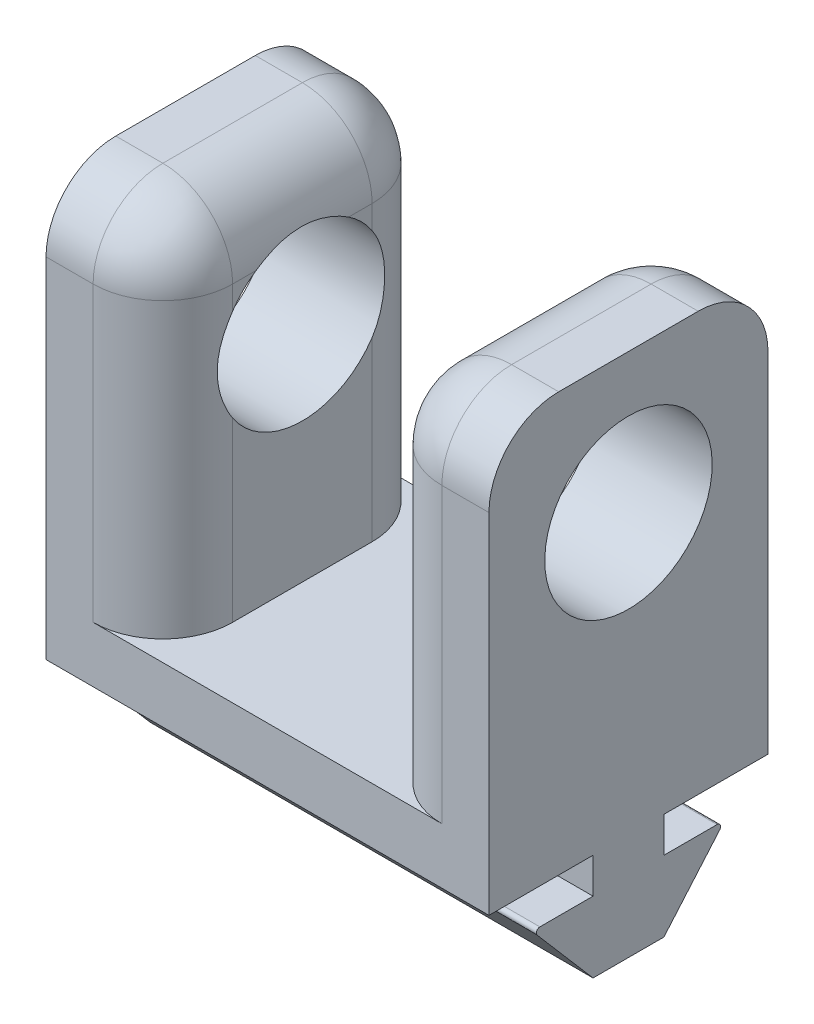
from build123d import *

# Parameters (mm, degrees)
SKETCH10_W              = 2.54
SKETCH10_H              = 5.08
SKETCH10_W_2            = 5.08
SKETCH10_H_2            = 2.54
BOSS_EXTRUDE3_DEPTH     = 31.75
SKETCH11_W              = 20
SKETCH11_H              = 4
BOSS_EXTRUDE4_DEPTH     = 31.75
CUT_EXTRUDE1_DEPTH      = 39.055781427
SKETCH13_W              = 8.375
SKETCH13_H              = 26
BOSS_EXTRUDE5_DEPTH     = 20
CUT_EXTRUDE2_DEPTH      = 50.695881369
CUT_EXTRUDE2_DEPTH_BACK = 50.695881369
SKETCH16_R              = 6
FILLET1_R               = 5


with BuildPart() as part:
    # Sketch10 → Boss-Extrude3 (new body)
    with BuildSketch(Plane(origin=(0, 0, 0), x_dir=(0, 0, -1), z_dir=(1, 0, 0))):
        with Locations((-11.43, 0)):
            Rectangle(SKETCH10_W, SKETCH10_H)
        with BuildLine():
            Line((-5.08, 2.54), (-9.740509205, 6.542688341))
            ThreePointArc((-9.740509205, 6.542688341), (-10.012022021, 6.580814495), (-10.16, 6.35))
            Line((-10.16, 6.35), (-10.16, -6.35))
            ThreePointArc((-10.16, -6.35), (-10.012022021, -6.580814495), (-9.740509205, -6.542688341))
            Line((-9.740509205, -6.542688341), (-5.08, -2.54))
            Line((-5.08, -2.54), (-5.08, 2.54))
        make_face()
        with BuildLine():
            Line((6.35, 10.16), (-6.35, 10.16))
            ThreePointArc((-6.35, 10.16), (-6.580814495, 10.012022021), (-6.542688341, 9.740509205))
            Line((-6.542688341, 9.740509205), (-2.54, 5.08))
            Line((-2.54, 5.08), (2.54, 5.08))
            Line((2.54, 5.08), (6.542688341, 9.740509205))
            ThreePointArc((6.542688341, 9.740509205), (6.580814495, 10.012022021), (6.35, 10.16))
        make_face()
        with Locations((0, 11.43)):
            Rectangle(SKETCH10_W_2, SKETCH10_H_2)
        with BuildLine():
            ThreePointArc((6.542688341, -9.740509205), (6.580814495, -10.012022021), (6.35, -10.16))
            Line((6.35, -10.16), (-6.35, -10.16))
            ThreePointArc((-6.35, -10.16), (-6.580814495, -10.012022021), (-6.542688341, -9.740509205))
            Line((-6.542688341, -9.740509205), (-2.54, -5.08))
            Line((-2.54, -5.08), (2.54, -5.08))
            Line((2.54, -5.08), (6.542688341, -9.740509205))
        make_face()
        with Locations((0, -11.43)):
            Rectangle(SKETCH10_W_2, SKETCH10_H_2)
        with BuildLine():
            Line((5.08, 2.54), (5.08, -2.54))
            Line((5.08, -2.54), (9.740509205, -6.542688341))
            ThreePointArc((9.740509205, -6.542688341), (10.012022021, -6.580814495), (10.16, -6.35))
            Line((10.16, -6.35), (10.16, -2.54))
            Line((10.16, -2.54), (10.16, 2.54))
            Line((10.16, 2.54), (10.16, 6.35))
            ThreePointArc((10.16, 6.35), (10.012022021, 6.580814495), (9.740509205, 6.542688341))
            Line((9.740509205, 6.542688341), (5.08, 2.54))
        make_face()
        with Locations((11.43, 0)):
            Rectangle(SKETCH10_W, SKETCH10_H)
    extrude(amount=-BOSS_EXTRUDE3_DEPTH)

    # Sketch11 → Boss-Extrude4 (add)
    with BuildSketch(Plane(origin=(0, 0, 0), x_dir=(0, 0, -1), z_dir=(1, 0, 0))):
        with Locations((0, 14.7)):
            Rectangle(SKETCH11_W, SKETCH11_H)
    extrude(amount=-BOSS_EXTRUDE4_DEPTH)

    # Sketch12 → Cut-Extrude1 (cut, through all)
    with BuildSketch(Plane.ZY.offset(31.75)):
        Polygon((0, 0), (-15.483602638, 16.020997712), (-15.483602638, -14.964233499), (16.01610749, -14.964233499), (16.01610749, 15.47887645), align=None)
    extrude(amount=-CUT_EXTRUDE1_DEPTH, mode=Mode.SUBTRACT)

    # Sketch13 → Boss-Extrude5 (add, through all)
    with BuildSketch(Plane(origin=(0, 0, -10), x_dir=(-1, 0, 0), z_dir=(0, 0, -1))):
        with Locations((4.1875, 29.7)):
            Rectangle(SKETCH13_W, SKETCH13_H)
        with Locations((27.5625, 29.7)):
            Rectangle(SKETCH13_W, SKETCH13_H)
    extrude(amount=-BOSS_EXTRUDE5_DEPTH)

    # Sketch16 → Cut-Extrude2 (cut, two sides: drawn at the far end of the back side and taken through both)
    with BuildSketch(Plane(origin=(-23.375, 0, 0), x_dir=(0, 0, -1), z_dir=(1, 0, 0)).offset(-CUT_EXTRUDE2_DEPTH_BACK)):
        with Locations(Location((0, 32.7, 0), (0, 0, 90))):
            Circle(SKETCH16_R)
    extrude(amount=CUT_EXTRUDE2_DEPTH + CUT_EXTRUDE2_DEPTH_BACK, mode=Mode.SUBTRACT)

    # Fillet1
    # the kernel refuses this fillet: 5 mm, written as the material it takes off along each edge
    with BuildSketch(Plane(origin=(-3.375, 37.7, 5), x_dir=(0, 1, 0), z_dir=(-1, 0, 0))) as fillet1_piece_1_section:
        Polygon((0, 0), (FILLET1_R * 1.02, 0), (FILLET1_R * 1.02, -FILLET1_R * 1.02), (0, -FILLET1_R * 1.02), align=None)
    fillet1_piece_1 = extrude(amount=FILLET1_R * 1.02, mode=Mode.PRIVATE)
    fillet1_piece_1 = fillet1_piece_1 - Plane(origin=(-3.375, 37.7, 5), x_dir=(0, -0.7071067811865475, -0.7071067811865475), z_dir=(-1, 0, 0)) * Sphere(FILLET1_R, mode=Mode.PRIVATE)
    add(fillet1_piece_1, mode=Mode.SUBTRACT)
    with BuildSketch(Plane(origin=(-3.375, 37.7, -5), x_dir=(0, 0, -1), z_dir=(-1, 0, 0))) as fillet1_piece_2_section:
        Polygon((0, 0), (FILLET1_R * 1.02, 0), (FILLET1_R * 1.02, -FILLET1_R * 1.02), (0, -FILLET1_R * 1.02), align=None)
    fillet1_piece_2 = extrude(amount=FILLET1_R * 1.02, mode=Mode.PRIVATE)
    fillet1_piece_2 = fillet1_piece_2 - Plane(origin=(-3.375, 37.7, -5), x_dir=(0, -0.7071067811865475, 0.7071067811865475), z_dir=(-1, 0, 0)) * Sphere(FILLET1_R, mode=Mode.PRIVATE)
    add(fillet1_piece_2, mode=Mode.SUBTRACT)
    with BuildSketch(Plane(origin=(-28.375, 37.7, 5), x_dir=(1, 0, 0), z_dir=(0, 1, 0))) as fillet1_piece_3_section:
        Polygon((0, 0), (FILLET1_R * 1.02, 0), (FILLET1_R * 1.02, -FILLET1_R * 1.02), (0, -FILLET1_R * 1.02), align=None)
    fillet1_piece_3 = extrude(amount=FILLET1_R * 1.02, mode=Mode.PRIVATE)
    fillet1_piece_3 = fillet1_piece_3 - Plane(origin=(-28.375, 37.7, 5), x_dir=(-0.7071067811865475, 0, -0.7071067811865475), z_dir=(0, 1, 0)) * Sphere(FILLET1_R, mode=Mode.PRIVATE)
    add(fillet1_piece_3, mode=Mode.SUBTRACT)
    with BuildSketch(Plane(origin=(-28.375, 37.7, -5), x_dir=(1, 0, 0), z_dir=(0, 1, 0))) as fillet1_piece_4_section:
        Polygon((0, 0), (FILLET1_R * 1.02, 0), (FILLET1_R * 1.02, FILLET1_R * 1.02), (0, FILLET1_R * 1.02), align=None)
    fillet1_piece_4 = extrude(amount=FILLET1_R * 1.02, mode=Mode.PRIVATE)
    fillet1_piece_4 = fillet1_piece_4 - Plane(origin=(-28.375, 37.7, -5), x_dir=(-0.7071067811865475, 0, 0.7071067811865475), z_dir=(0, 1, 0)) * Sphere(FILLET1_R, mode=Mode.PRIVATE)
    add(fillet1_piece_4, mode=Mode.SUBTRACT)
    with BuildSketch(Plane(origin=(12.5, 42.7, 10), x_dir=(0, 0, -1), z_dir=(-1, 0, 0)), Plane(origin=(12.5, 42.7, -10), x_dir=(0, -1, 0), z_dir=(-1, 0, 0)), Plane(origin=(-28.375, 42.7, -10), x_dir=(0, -1, 0), z_dir=(-1, 0, 0))) as fillet1_piece_5:
        with BuildLine():
            CenterArc((FILLET1_R, FILLET1_R), FILLET1_R, 180, 90)
            Line((0, FILLET1_R), (0, 0))
            Line((0, 0), (FILLET1_R, 0))
        make_face()
    extrude(amount=15.875, mode=Mode.SUBTRACT)
    with BuildSketch(Plane(origin=(-8.375, 37.7, 10), x_dir=(1, 0, 0), z_dir=(0, -1, 0)), Plane(origin=(-23.375, 16.7, 10), x_dir=(-1, 0, 0), z_dir=(0, 1, 0))) as fillet1_piece_6:
        with BuildLine():
            CenterArc((FILLET1_R, -FILLET1_R), FILLET1_R, 90, 90)
            Line((0, -FILLET1_R), (0, 0))
            Line((0, 0), (FILLET1_R, 0))
        make_face()
    extrude(amount=21, mode=Mode.SUBTRACT)
    with BuildSketch(Plane(origin=(-8.375, 42.7, -5), x_dir=(1, 0, 0), z_dir=(0, 0, 1))) as fillet1_piece_7:
        with BuildLine():
            CenterArc((FILLET1_R, -FILLET1_R), FILLET1_R, 90, 90)
            Line((0, -FILLET1_R), (0, 0))
            Line((0, 0), (FILLET1_R, 0))
        make_face()
    extrude(amount=10, mode=Mode.SUBTRACT)
    with BuildSketch(Plane(origin=(-8.375, 37.7, -10), x_dir=(1, 0, 0), z_dir=(0, -1, 0)), Plane(origin=(-23.375, 16.7, -10), x_dir=(-1, 0, 0), z_dir=(0, 1, 0))) as fillet1_piece_8:
        with BuildLine():
            CenterArc((FILLET1_R, FILLET1_R), FILLET1_R, 180, 90)
            Line((0, FILLET1_R), (0, 0))
            Line((0, 0), (FILLET1_R, 0))
        make_face()
    extrude(amount=21, mode=Mode.SUBTRACT)
    with BuildSketch(Plane(origin=(-28.375, 42.7, 10), x_dir=(0, -1, 0), z_dir=(-1, 0, 0))) as fillet1_piece_9:
        with BuildLine():
            CenterArc((FILLET1_R, -FILLET1_R), FILLET1_R, 90, 90)
            Line((0, -FILLET1_R), (0, 0))
            Line((0, 0), (FILLET1_R, 0))
        make_face()
    extrude(amount=15.875, mode=Mode.SUBTRACT)
    with BuildSketch(Plane(origin=(-23.375, 42.7, -5), x_dir=(-1, 0, 0), z_dir=(0, 0, 1))) as fillet1_piece_10:
        with BuildLine():
            CenterArc((FILLET1_R, FILLET1_R), FILLET1_R, 180, 90)
            Line((0, FILLET1_R), (0, 0))
            Line((0, 0), (FILLET1_R, 0))
        make_face()
    extrude(amount=10, mode=Mode.SUBTRACT)


solid = part.part
